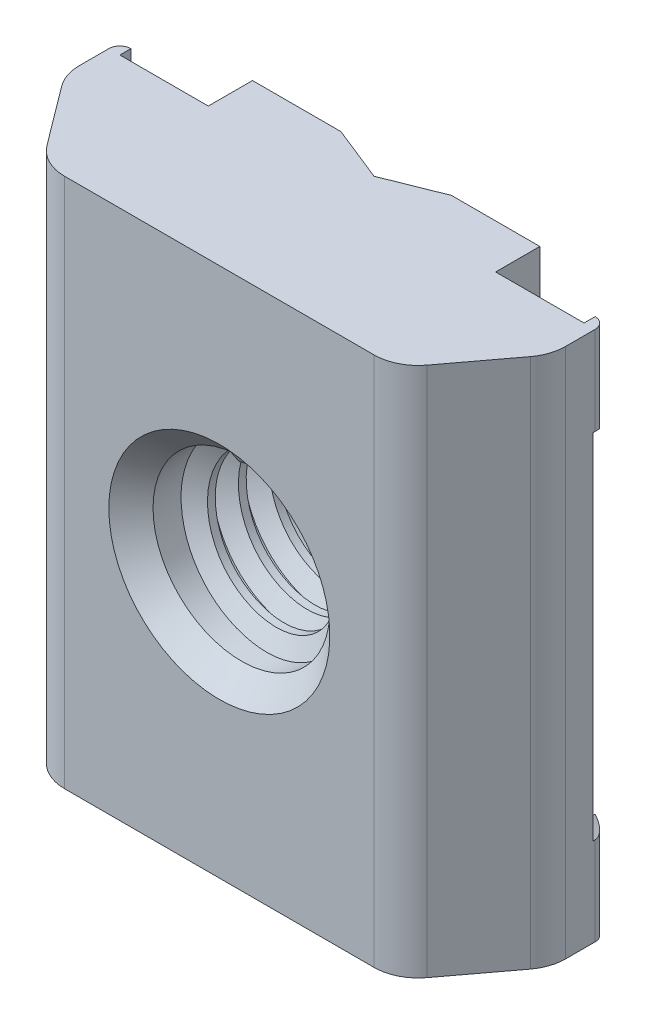
from build123d import *

# Parameters (mm, degrees)
BOSS_EXTRUDE1_DEPTH = 12
FILLET1_R           = 1
SKETCH4_R           = 2
CUT_EXTRUDE1_DEPTH  = 16.81929202
THREAD1_PITCH       = 0.7
CHAMFER2_SIZE       = 0.5
CHAMFER4_SIZE       = 0.5
CUT_EXTRUDE2_DEPTH  = 0.3
FILLET4_R           = 0.25


with BuildPart() as part:
    # Sketch2 → Boss-Extrude1 (new body)
    with BuildSketch(Plane(origin=(0, 0, 0), x_dir=(1, 0, 0), z_dir=(0, 1, 0))):
        Polygon((0, 0), (8, 0), (9.5, 2), (9.5, 3.25), (9.25, 3.25), (9.25, 3), (7.25, 3), (7.25, 4), (5.25, 4), (4, 3.5), (2.75, 4), (0.75, 4), (0.75, 3), (-1.25, 3), (-1.25, 3.25), (-1.5, 3.25), (-1.5, 2), align=None)
    extrude(amount=BOSS_EXTRUDE1_DEPTH)

    # Fillet1
    fillet1_edges = [part.edges().sort_by_distance(p)[0] for p in [
        (-1.5, 6, -2),
        (9.5, 6, -2),
        (8, 6, 0),
        (0, 6, 0),
    ]]
    fillet(fillet1_edges, radius=FILLET1_R)

    # Sketch4 → Cut-Extrude1 (cut, through all)
    with BuildSketch(Plane(origin=(0, 0, -4), x_dir=(-1, 0, 0), z_dir=(0, 0, -1))):
        with Locations((-4, 6)):
            Circle(SKETCH4_R)
    extrude(amount=-CUT_EXTRUDE1_DEPTH, mode=Mode.SUBTRACT)

    # Thread1: arcs per turn and ends read off the stored shape
    # Thread1: the profile of Thread Profile1 profile screwed along a right-hand helix through 3.285711 turns, 6 arcs to a turn; built about Z, then put on its axis
    thread1_z = Axis((0, 0, 0), (0, 0, 1))
    thread1_corners = [(2.0003, 0, -0.000173205), (2.0003, 0, 0.612673203), (1.621113887, 0, 0.393749999), (1.621113887, 0, 0.218749999)]
    with BuildLine(mode=Mode.PRIVATE) as thread1_profile:
        Line(thread1_corners[0], thread1_corners[1])
        Line(thread1_corners[1], thread1_corners[2])
        Line(thread1_corners[2], thread1_corners[3])
        Line(thread1_corners[3], thread1_corners[0])
    thread1_cap = Face(thread1_profile.wire())
    thread1_turn_angles = [0, 30, 60, 90, 120, 150, 180, 210, 240, 270, 300, 330, 360]
    thread1_turn_weights = [1, 0.8660254037844387, 1, 0.8660254037844387, 1, 0.8660254037844387, 1, 0.8660254037844387, 1, 0.8660254037844387, 1, 0.8660254037844387, 1]
    thread1_turn_rails = [Edge.make_bspline([Vector(p[0], p[1], 0).rotate(thread1_z, thread1_turn_angles[k]) / thread1_turn_weights[k] + Vector(0, 0, p[2] + THREAD1_PITCH * thread1_turn_angles[k] / 360) for k in range(13)], [0, 0, 0, 1, 1, 2, 2, 3, 3, 4, 4, 5, 5, 6, 6, 6], 2, thread1_turn_weights) for p in thread1_corners]
    thread1_turn_sides = [Face.make_surface_from_curves(thread1_turn_rails[p[0]], thread1_turn_rails[p[1]]) for p in [(0, 1), (1, 2), (2, 3), (3, 0)]]
    thread1_last_angles = [1080, 1110, 1140, 1161.428, 1182.856]
    thread1_last_weights = [1, 0.8660254037844387, 1, 0.9308773922572046, 1]
    thread1_last_rails = [Edge.make_bspline([Vector(p[0], p[1], 0).rotate(thread1_z, thread1_last_angles[k]) / thread1_last_weights[k] + Vector(0, 0, p[2] + THREAD1_PITCH * thread1_last_angles[k] / 360) for k in range(5)], [0, 0, 0, 1, 1, 2, 2, 2], 2, thread1_last_weights) for p in thread1_corners]
    thread1_last_sides = [Face.make_surface_from_curves(thread1_last_rails[p[0]], thread1_last_rails[p[1]]) for p in [(0, 1), (1, 2), (2, 3), (3, 0)]]
    thread1 = Plane(origin=(4, 6, -3.5), x_dir=(1, 0, 0), z_dir=(0, 0, 1)) * Solid(Shell([*[p.moved(Location((0, 0, THREAD1_PITCH * i))) for i in range(3) for p in thread1_turn_sides], *thread1_last_sides, thread1_cap, thread1_cap.rotate(thread1_z, 1182.856).moved(Location((0, 0, THREAD1_PITCH * 1182.856 / 360)))]))
    add(thread1)

    # Chamfer2
    # the kernel refuses this chamfer: 0.5 mm, written as the material it takes off along each edge
    with BuildSketch(Plane(origin=(4, 6, -4), x_dir=(-0.4063033524336664, 0.9137382479688392, 0), z_dir=(-0.9137382479688392, -0.4063033524336664, 0))) as chamfer2_piece_1:
        Polygon((2 + CHAMFER2_SIZE, 0), (2, -CHAMFER2_SIZE), (2, 0), align=None)
    revolve(axis=Axis((4, 6, -4), (0, 0, -1)), revolution_arc=227.945655457, mode=Mode.SUBTRACT)
    with BuildSketch(Plane(origin=(4, 6, -4), x_dir=(-1, 0, 0), z_dir=(0, -1, 0))) as chamfer2_piece_2:
        Polygon((2 + CHAMFER2_SIZE, 0), (2, -CHAMFER2_SIZE), (2, 0), align=None)
    revolve(axis=Axis((4, 6, -4), (0, 0, -1)), revolution_arc=113.948286938, mode=Mode.SUBTRACT)
    with BuildSketch(Plane(origin=(4, 6, -4), x_dir=(0.4059119450129516, -0.9139121910204517, 0), z_dir=(0.9139121910204517, 0.4059119450129516, 0))) as chamfer2_piece_3:
        Polygon((2 + CHAMFER2_SIZE, 0), (2, -CHAMFER2_SIZE), (2, 0), align=None)
    revolve(axis=Axis((4, 6, -4), (0, 0, -1)), revolution_arc=113.948286938, mode=Mode.SUBTRACT)

    # Chamfer4
    chamfer4_edges = [part.edges().sort_by_distance(p)[0] for p in [
        (6, 6, 0),
    ]]
    chamfer(chamfer4_edges, length=CHAMFER4_SIZE)

    # Sketch8 → Cut-Extrude2 (cut)
    with BuildSketch(Plane(origin=(0, 0, -3.25), x_dir=(-1, 0, 0), z_dir=(0, 0, -1))):
        with BuildLine():
            Line((-9.5, 10), (-9.5, 2))
            ThreePointArc((-9.5, 2), (-7.774917218, 6), (-9.5, 10))
        make_face()
        with BuildLine():
            Line((1.5, 10), (1.5, 2))
            ThreePointArc((1.5, 2), (-0.225082782, 6), (1.5, 10))
        make_face()
    extrude(amount=-CUT_EXTRUDE2_DEPTH, mode=Mode.SUBTRACT)

    # Fillet4
    fillet4_edges = [part.edges().sort_by_distance(p)[0] for p in [
        (-1.5, 11, -3.25),
        (-1.5, 1, -3.25),
        (9.5, 11, -3.25),
        (9.5, 1, -3.25),
    ]]
    fillet(fillet4_edges, radius=FILLET4_R - 0.0001)  # a hair under: the kernel refuses the full size


solid = part.part
